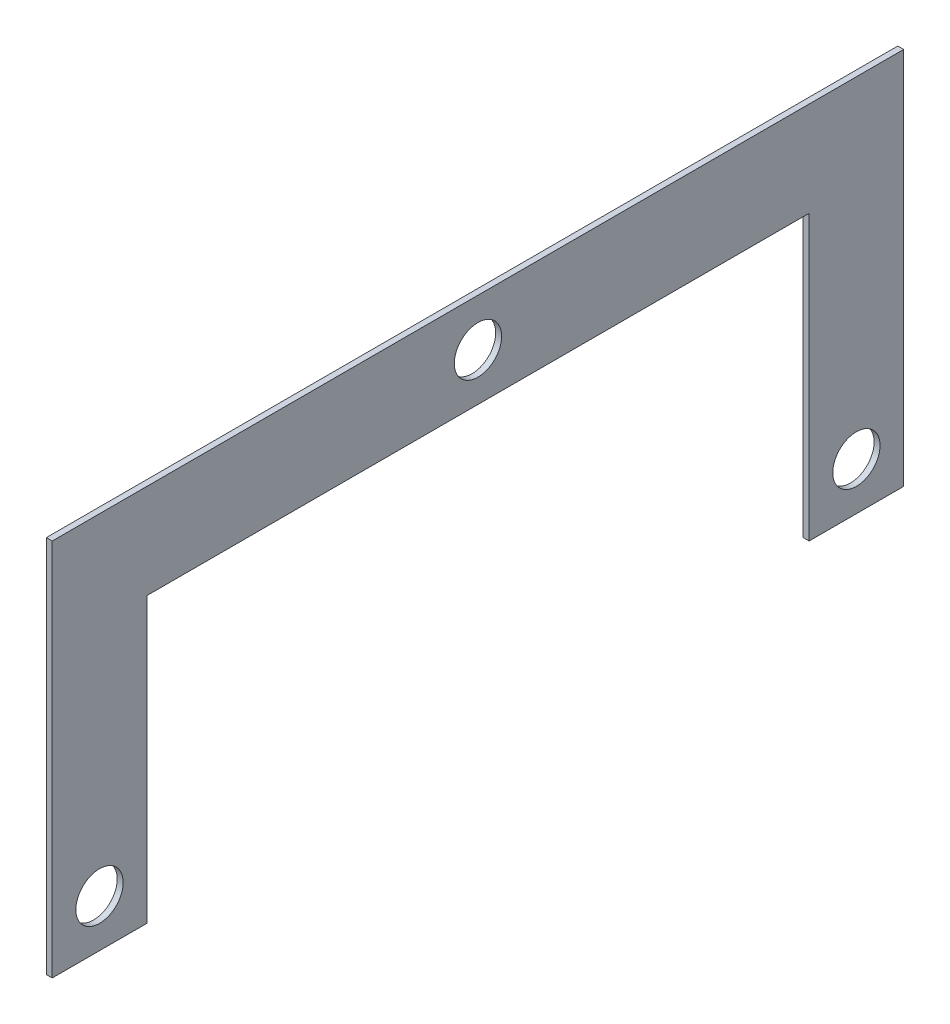
from build123d import *

# Parameters (mm, degrees)
SKETCH1_R           = 12.7
BOSS_EXTRUDE1_DEPTH = 3.175
SKETCH3_R           = 12.7
CUT_EXTRUDE1_DEPTH  = 290.621961572


with BuildPart() as part:
    # Sketch1 → Boss-Extrude1 (new body)
    with BuildSketch(Plane(origin=(0, 0, 0), x_dir=(0, 0, -1), z_dir=(1, 0, 0))):
        Polygon((-228.6, 25.4), (228.6, 25.4), (228.6, -177.8), (177.8, -177.8), (177.8, -25.4), (-177.8, -25.4), (-177.8, -177.8), (-228.6, -177.8), align=None)
        Circle(SKETCH1_R, mode=Mode.SUBTRACT)
    extrude(amount=BOSS_EXTRUDE1_DEPTH)

    # Sketch3 → Cut-Extrude1 (cut, through all)
    with BuildSketch(Plane(origin=(3.175, 0, 0), x_dir=(0, 0, -1), z_dir=(1, 0, 0))):
        with Locations((-203.2, -152.4)):
            Circle(SKETCH3_R)
        with Locations((203.2, -152.4)):
            Circle(SKETCH3_R)
    extrude(amount=-CUT_EXTRUDE1_DEPTH, mode=Mode.SUBTRACT)


solid = part.part
